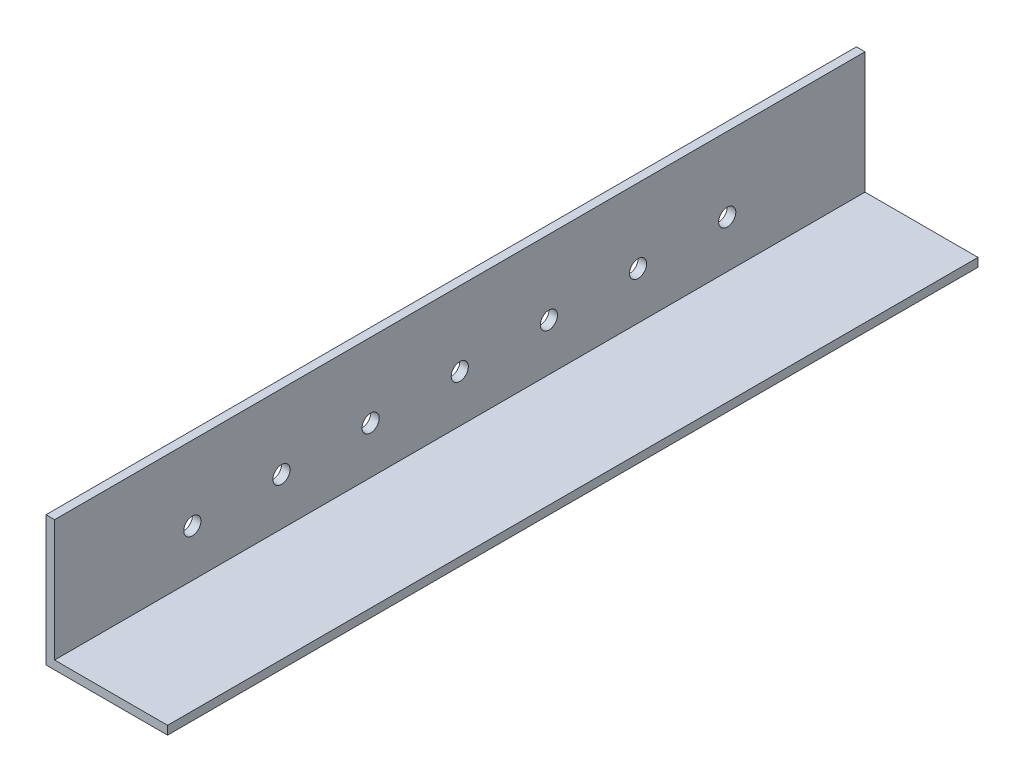
from build123d import *

# Parameters (mm, degrees)
SALIENTE_EXTRUIR1_DEPTH = 150
CROQUIS2_R              = 3.175
CORTAR_EXTRUIR1_DEPTH   = 50


with BuildPart() as part:
    # Croquis1 → Saliente-Extruir1 (new, symmetric)
    with BuildSketch(Plane.XY):
        Polygon((-22.5, -25.675), (22.5, -25.675), (22.5, -22.5), (-19.325, -22.5), (-19.325, 22.5), (-22.5, 22.5), align=None)
    extrude(amount=SALIENTE_EXTRUIR1_DEPTH, both=True)

    # Croquis2 → Cortar-Extruir1 (cut)
    with BuildSketch(Plane(origin=(0, 0, 0), x_dir=(0, 0, -1), z_dir=(1, 0, 0))):
        with Locations((0, -5)):
            Circle(CROQUIS2_R)
        with Locations((33, -5)):
            Circle(CROQUIS2_R)
        with Locations((66, -5)):
            Circle(CROQUIS2_R)
        with Locations((99, -5)):
            Circle(CROQUIS2_R)
        with Locations((-99, -5)):
            Circle(CROQUIS2_R)
        with Locations((-66, -5)):
            Circle(CROQUIS2_R)
        with Locations((-33, -5)):
            Circle(CROQUIS2_R)
    extrude(amount=-CORTAR_EXTRUIR1_DEPTH, mode=Mode.SUBTRACT)


solid = part.part
